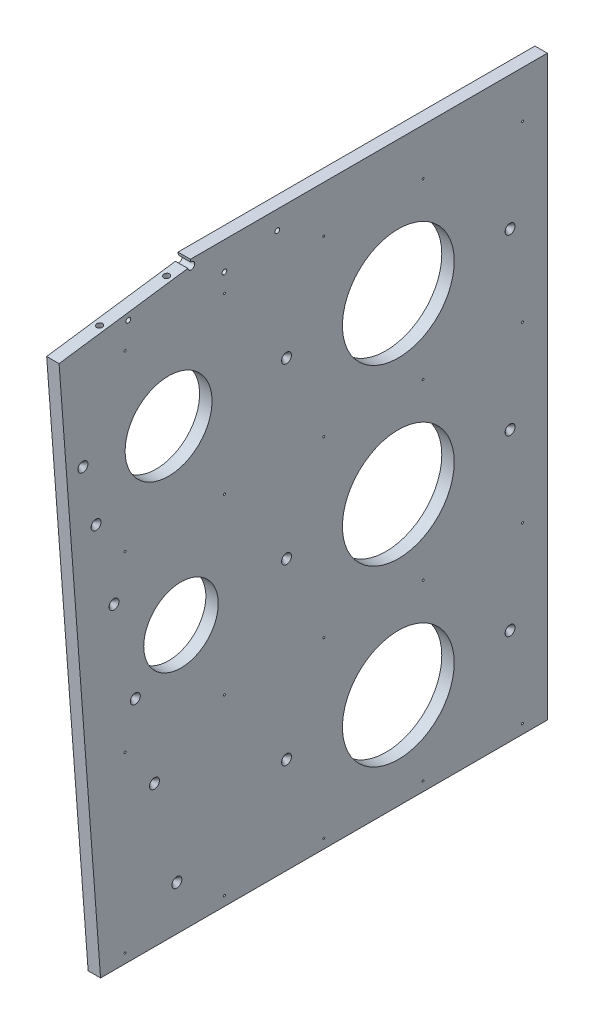
from build123d import *

# Parameters (mm, degrees)
CUT_EXTRUDE1_START                   = -12.7
CUT_EXTRUDE1_OUTLINE_R               = 38.1
CUT_EXTRUDE1_OUTLINE_R_2             = 2.413
CUT_EXTRUDE1_OUTLINE_R_3             = 44.45
CUT_EXTRUDE1_DEPTH                   = 12.7
F_15_64_0_23438_DIAMETER_HOLE1_D     = 5.953252
F_15_64_0_23438_DIAMETER_HOLE1_DEPTH = 12.7
F_15_64_0_23438_DIAMETER_HOLE1_TIP   = 1.788537341
HOLE2_D                              = 1.98374
HOLE2_DEPTH                          = 31.75
HOLE2_CSINK_D                        = 10.16
HOLE2_CSINK_ANGLE                    = 82
HOLE2_TIP                            = 0.595975622
HOLE3_D                              = 1.98374
HOLE3_DEPTH                          = 38.1
HOLE3_CSINK_D                        = 10.16
HOLE3_CSINK_ANGLE                    = 82
HOLE3_TIP                            = 0.595975622
SKETCH10_R                           = 2.413
BOSS_EXTRUDE1_DEPTH                  = 12.7
F_8_CLEARANCE_HOLE1_D                = 4.9149
SKETCH13_R                           = 57.15
CUT_EXTRUDE2_DEPTH                   = 6640.775655858
CUT_EXTRUDE3_REACH                   = 6641.776
SKETCH14_R                           = 3.556


with BuildPart() as part:
    # Cut-Extrude1: read off the stored shape, not the designer's step
    # Cut-Extrude1 outline → Cut-Extrude1 (new body)
    with BuildSketch(Plane.ZY.offset(-312.42).offset(CUT_EXTRUDE1_START)):
        Polygon((2759.71, 5194.3), (3216.602441012, 5194.3), (3259.024301591, 5759.628633772), (3123.858554164, 5778.624940739), (3124.742303355, 5784.913142975), (2759.71, 5784.913142975), align=None)
        with Locations((3134.36, 5465.854797853)):
            Circle(CUT_EXTRUDE1_OUTLINE_R, mode=Mode.SUBTRACT)
        with Locations((3035.935, 5765.8)):
            Circle(CUT_EXTRUDE1_OUTLINE_R_2, mode=Mode.SUBTRACT)
        with Locations((3089.91, 5756.275)):
            Circle(CUT_EXTRUDE1_OUTLINE_R_2, mode=Mode.SUBTRACT)
        with Locations((3147.06, 5648.325)):
            Circle(CUT_EXTRUDE1_OUTLINE_R_3, mode=Mode.SUBTRACT)
        with Locations((3194.557898027, 5765.8)):
            Circle(CUT_EXTRUDE1_OUTLINE_R_2, mode=Mode.SUBTRACT)
    extrude(amount=CUT_EXTRUDE1_DEPTH)

    # 15/64 (0.23438) Diameter Hole1
    with Locations(Plane(origin=(0, 6097.22393164, 856.90894072), x_dir=(1, 0, 0), z_dir=(0, 0.9902680687415711, 0.13917310096005983))):
        with Locations((318.77, -2308.278225166), (318.77, -2377.493225166)):
            Hole(F_15_64_0_23438_DIAMETER_HOLE1_D / 2, depth=F_15_64_0_23438_DIAMETER_HOLE1_DEPTH)
            with Locations((0, 0, -(F_15_64_0_23438_DIAMETER_HOLE1_DEPTH + F_15_64_0_23438_DIAMETER_HOLE1_TIP / 2))):  # 118° drill point
                Cone(0, F_15_64_0_23438_DIAMETER_HOLE1_D / 2, F_15_64_0_23438_DIAMETER_HOLE1_TIP, mode=Mode.SUBTRACT)

    # Hole2
    with Locations(Plane.ZY.offset(-312.42)):
        with Locations((2785.11, 5737.225), (2785.11, 5559.425), (2785.11, 5381.625), (2785.11, 5203.825), (2886.71, 5737.225), (2886.71, 5559.425), (2886.71, 5381.625), (2886.71, 5203.825), (2988.31, 5737.225), (2988.31, 5559.425), (2988.31, 5381.625), (2988.31, 5203.825), (3089.91, 5737.225), (3089.91, 5559.425), (3089.91, 5381.625), (3089.91, 5203.825), (3191.51, 5737.225), (3191.51, 5559.425), (3191.51, 5381.625), (3191.51, 5203.825)):
            CounterSinkHole(HOLE2_D / 2, HOLE2_CSINK_D / 2, depth=HOLE2_DEPTH, counter_sink_angle=HOLE2_CSINK_ANGLE)
            with Locations((0, 0, -(HOLE2_DEPTH + HOLE2_TIP / 2))):  # 118° drill point
                Cone(0, HOLE2_D / 2, HOLE2_TIP, mode=Mode.SUBTRACT)

    # Hole3
    with Locations(Plane(origin=(325.12, 0, 0), x_dir=(0, 0, -1), z_dir=(1, 0, 0))):
        with Locations((-3138.579391202, 5239.970762716), (-3026.41, 5648.325), (-2797.81, 5648.325), (-2797.81, 5470.525), (-3026.41, 5470.525), (-2797.81, 5292.725), (-3026.41, 5292.725), (-3234.623500844, 5655.983506494), (-3221.227988703, 5597.961168831), (-3202.861240688, 5518.406042918), (-3181.048381979, 5423.92417167), (-3161.457719707, 5339.067690679)):
            CounterSinkHole(HOLE3_D / 2, HOLE3_CSINK_D / 2, depth=HOLE3_DEPTH, counter_sink_angle=HOLE3_CSINK_ANGLE)
            with Locations((0, 0, -(HOLE3_DEPTH + HOLE3_TIP / 2))):  # 118° drill point
                Cone(0, HOLE3_D / 2, HOLE3_TIP, mode=Mode.SUBTRACT)

    # Sketch10 → Boss-Extrude1 (add, through all)
    with BuildSketch(Plane.ZY.offset(-312.42)):
        with Locations((3194.557898027, 5765.8)):
            Circle(SKETCH10_R)
    extrude(amount=-BOSS_EXTRUDE1_DEPTH)

    # #8 Clearance Hole1 (through all)
    with Locations(Plane(origin=(325.12, 0, 0), x_dir=(0, 0, -1), z_dir=(1, 0, 0))):
        with Locations((-3188.207898027, 5762.625)):
            Hole(F_8_CLEARANCE_HOLE1_D / 2)

    # Sketch13 → Cut-Extrude2 (cut, through all)
    with BuildSketch(Plane(origin=(325.12, 0, 0), x_dir=(0, 0, -1), z_dir=(1, 0, 0))):
        with Locations((-2912.11, 5648.325)):
            Circle(SKETCH13_R)
        with Locations((-2912.11, 5470.525)):
            Circle(SKETCH13_R)
        with Locations((-2912.11, 5292.725)):
            Circle(SKETCH13_R)
    extrude(amount=-CUT_EXTRUDE2_DEPTH, mode=Mode.SUBTRACT)

    # Sketch14 → Cut-Extrude3 (cut, up to next)
    with BuildSketch(Plane(origin=(325.12, 0, 0), x_dir=(0, 0, -1), z_dir=(1, 0, 0)), mode=Mode.PRIVATE) as cut_extrude3_sk1:
        with Locations((-3123.858554164, 5778.624940739)):
            Circle(SKETCH14_R)
    cut_extrude3_tool1 = extrude(cut_extrude3_sk1.sketch, amount=-CUT_EXTRUDE3_REACH, mode=Mode.PRIVATE) & part.part
    add(cut_extrude3_tool1.solids().sort_by_distance((325.12, 5778.624941, 3123.858554))[0], mode=Mode.SUBTRACT)


solid = part.part
